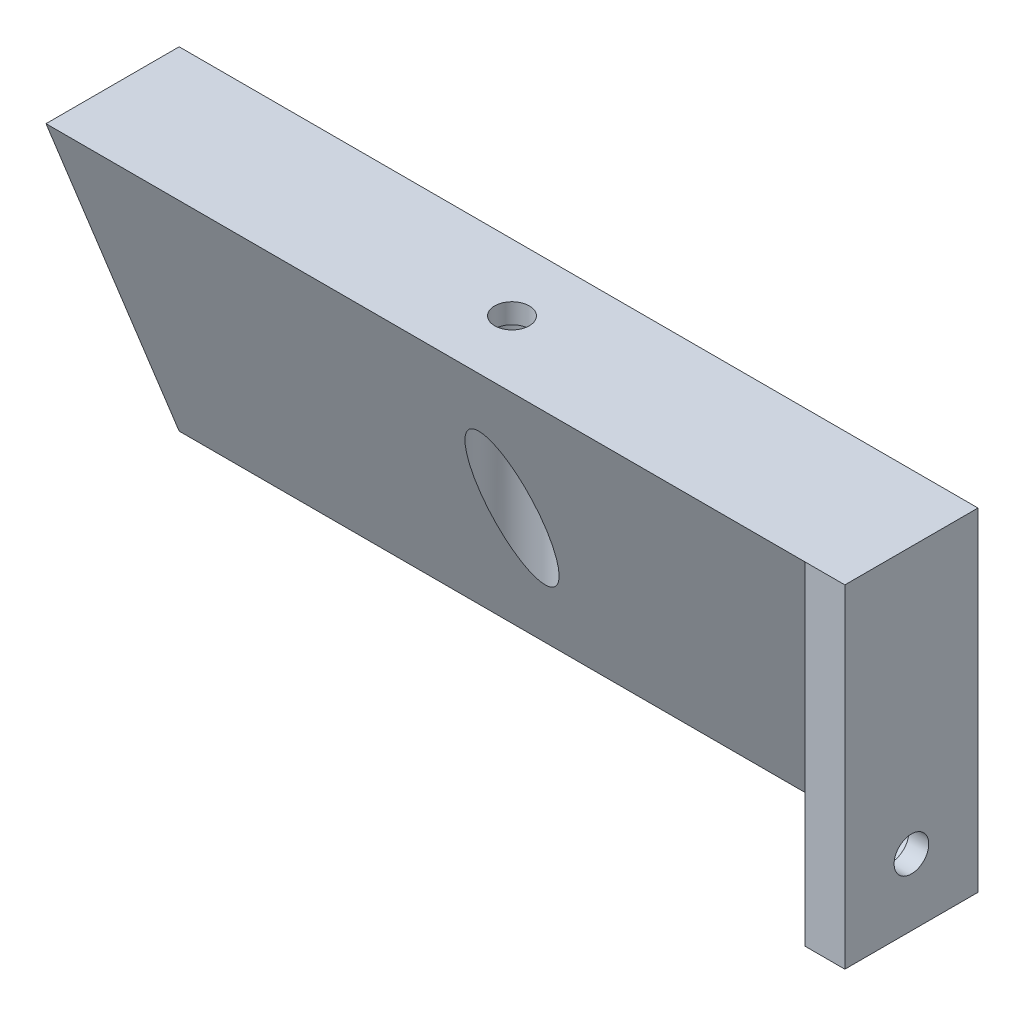
from build123d import *

# Parameters (mm, degrees)
SKETCH_1_W          = 120
SKETCH_1_H          = 20
EXTRUDE_1_DEPTH     = 50
SKETCH_2_W          = 6
SKETCH_2_H          = 20
EXTRUDE_2_DEPTH     = 20
CUT_EXTRUDE_1_DEPTH = 114
SKETCH_4_R          = 2.6
SKETCH_4_W          = 20
SKETCH_4_H          = 20
CUT_EXTRUDE_2_DEPTH = 114
SKETCH_5_R          = 5
CUT_EXTRUDE_3_DEPTH = 3
SKETCH_6_R          = 2.6
CUT_EXTRUDE_4_DEPTH = 300
SKETCH_8_R          = 5
CUT_EXTRUDE_5_DEPTH = 300
SKETCH_9_R          = 5
SKETCH_9_R_2        = 2.6
EXTRUDE_3_DEPTH     = 3
SKETCH_11_W         = 120
SKETCH_11_H         = 20
CUT_EXTRUDE_6_DEPTH = 100


with BuildPart() as part:
    # 草图1 → 凸台-拉伸1 (new body)
    with BuildSketch(Plane(origin=(0, 0, 0), x_dir=(1, 0, 0), z_dir=(0, 1, 0))):
        with Locations((60, 10)):
            Rectangle(SKETCH_1_W, SKETCH_1_H)
    extrude_1 = extrude(amount=EXTRUDE_1_DEPTH)

    # 草图2 → 凸台-拉伸2 (add)
    with BuildSketch(Plane.XY):
        with Locations((3, -10)):
            Rectangle(SKETCH_2_W, SKETCH_2_H)
    extrude_2 = extrude(amount=-EXTRUDE_2_DEPTH)

    # 草图3 → 切除-拉伸1 (cut)
    with BuildSketch(Plane(origin=(120, 0, 0), x_dir=(0, 0, -1), z_dir=(1, 0, 0))):
        Polygon((0, 50), (20, 0), (0, 0), align=None)
    cut_extrude_1 = extrude(amount=-CUT_EXTRUDE_1_DEPTH, mode=Mode.SUBTRACT)

    # 草图4 → 切除-拉伸2 (cut)
    with BuildSketch(Plane(origin=(6, 0, 0), x_dir=(0, 0, -1), z_dir=(1, 0, 0))):
        with Locations((10, 10)):
            Circle(SKETCH_4_R)
        with Locations((10, -10)):
            Rectangle(SKETCH_4_W, SKETCH_4_H)
    cut_extrude_2 = extrude(amount=-CUT_EXTRUDE_2_DEPTH, mode=Mode.SUBTRACT)

    # 草图5 → 切除-拉伸3 (cut)
    with BuildSketch(Plane(origin=(6, 0, 0), x_dir=(0, 0, -1), z_dir=(1, 0, 0))):
        with Locations((10, 10)):
            Circle(SKETCH_5_R)
    cut_extrude_3 = extrude(amount=-CUT_EXTRUDE_3_DEPTH, mode=Mode.SUBTRACT)

    # 草图6 → 切除-拉伸4 (cut)
    with BuildSketch(Plane(origin=(0, 50, 0), x_dir=(1, 0, 0), z_dir=(0, 1, 0))):
        with Locations((60, 10)):
            Circle(SKETCH_6_R)
    extrude(amount=-CUT_EXTRUDE_4_DEPTH, mode=Mode.SUBTRACT)

    # 草图8 → 切除-拉伸5 (cut)
    with BuildSketch(Plane(origin=(0, 50, 0), x_dir=(1, 0, 0), z_dir=(0, 1, 0))):
        with Locations((60, 10)):
            Circle(SKETCH_8_R)
    cut_extrude_5 = extrude(amount=-CUT_EXTRUDE_5_DEPTH, mode=Mode.SUBTRACT)

    # 草图9 → 凸台-拉伸3 (add)
    with BuildSketch(Plane(origin=(0, 50, 0), x_dir=(1, 0, 0), z_dir=(0, 1, 0))):
        with Locations((60, 10)):
            Circle(SKETCH_9_R)
        with Locations((60, 10)):
            Circle(SKETCH_9_R_2, mode=Mode.SUBTRACT)
    extrude_3 = extrude(amount=-EXTRUDE_3_DEPTH)

    # 镜向2: 凸台-拉伸1, 凸台-拉伸2, 切除-拉伸1, 切除-拉伸2, 切除-拉伸3, 切除-拉伸5, 凸台-拉伸3 across plane
    add(extrude_1.mirror(Plane(origin=(120, 50, 0), x_dir=(0, 0, 1), z_dir=(-1, 0, 0))))
    add(extrude_2.mirror(Plane(origin=(120, 50, 0), x_dir=(0, 0, 1), z_dir=(-1, 0, 0))))
    add(cut_extrude_1.mirror(Plane(origin=(120, 50, 0), x_dir=(0, 0, 1), z_dir=(-1, 0, 0))), mode=Mode.SUBTRACT)
    add(cut_extrude_2.mirror(Plane(origin=(120, 50, 0), x_dir=(0, 0, 1), z_dir=(-1, 0, 0))), mode=Mode.SUBTRACT)
    add(cut_extrude_3.mirror(Plane(origin=(120, 50, 0), x_dir=(0, 0, 1), z_dir=(-1, 0, 0))), mode=Mode.SUBTRACT)
    add(cut_extrude_5.mirror(Plane(origin=(120, 50, 0), x_dir=(0, 0, 1), z_dir=(-1, 0, 0))), mode=Mode.SUBTRACT)
    add(extrude_3.mirror(Plane(origin=(120, 50, 0), x_dir=(0, 0, 1), z_dir=(-1, 0, 0))))

    # 草图11 → 切除-拉伸6 (cut)
    with BuildSketch(Plane(origin=(0, 50, 0), x_dir=(1, 0, 0), z_dir=(0, 1, 0))):
        with Locations((60, 10)):
            Rectangle(SKETCH_11_W, SKETCH_11_H)
    extrude(amount=-CUT_EXTRUDE_6_DEPTH, mode=Mode.SUBTRACT)


solid = part.part
